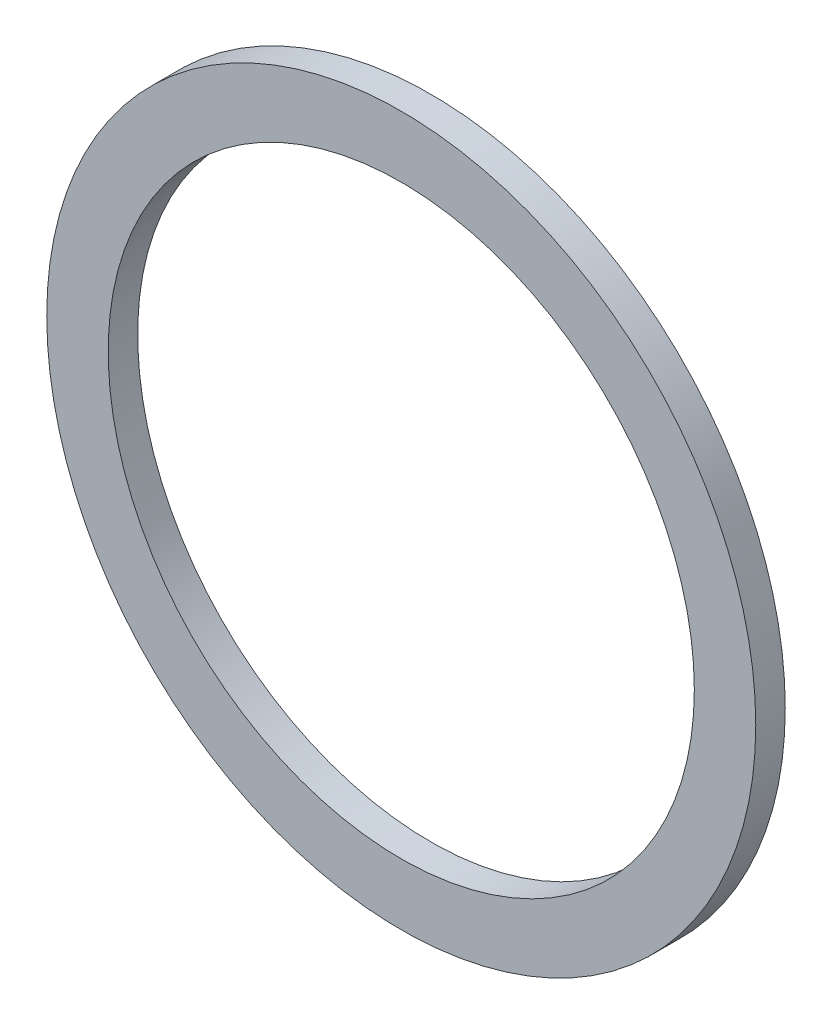
from build123d import *

# Parameters (mm, degrees)
SKETCH1_R           = 36.6395
SKETCH1_R_2         = 30.2895
BOSS_EXTRUDE1_DEPTH = 3.048


with BuildPart() as part:
    # Sketch1 → Boss-Extrude1 (new body)
    with BuildSketch(Plane.XY):
        with Locations(Location((0, 0, 0), (0, 0, 180))):
            Circle(SKETCH1_R)
        with Locations(Location((0, 0, 0), (0, 0, 180))):
            Circle(SKETCH1_R_2, mode=Mode.SUBTRACT)
    extrude(amount=BOSS_EXTRUDE1_DEPTH)


solid = part.part
